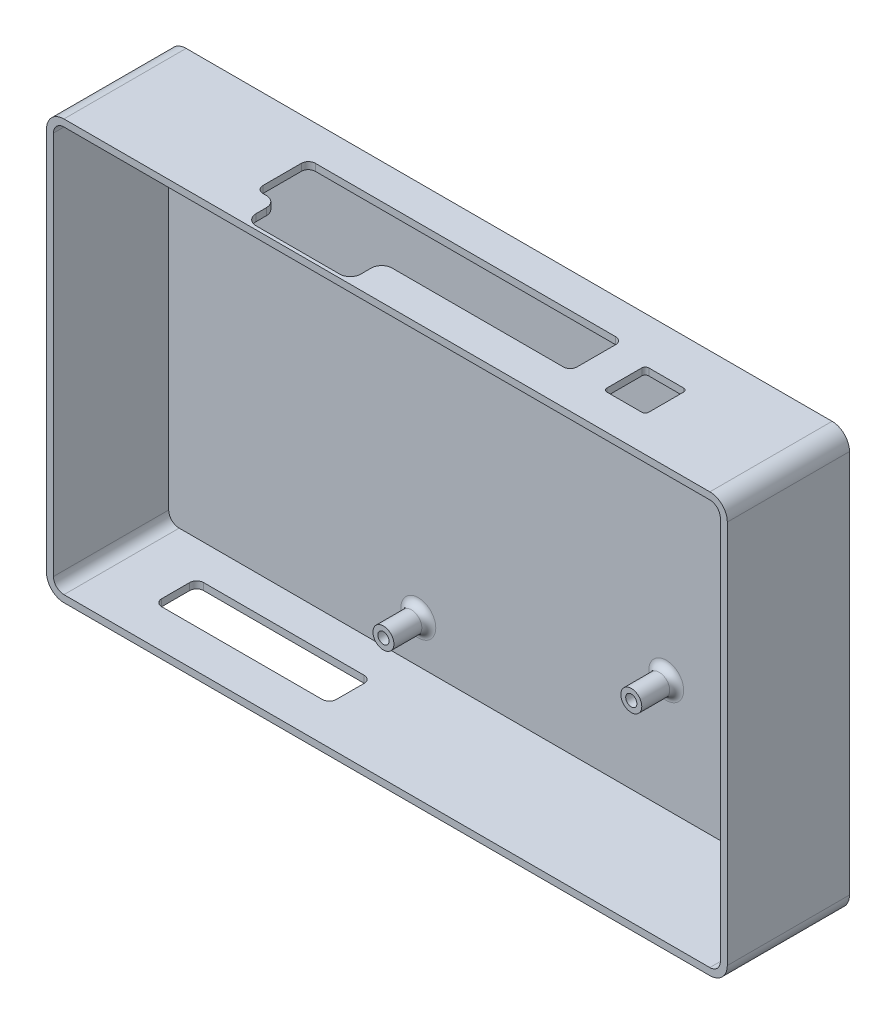
from build123d import *

# Parameters (mm, degrees)
BOSS_EXTRU_1_DEPTH      = 35
COQUE1_T                = -2
ESQUISSE2_W             = 12
ESQUISSE2_H             = 12
ENL_V_MAT_EXTRU_1_DEPTH = 10
ESQUISSE3_W             = 30
ESQUISSE3_H             = 9
ENL_V_MAT_EXTRU_2_DEPTH = 10
ESQUISSE4_W             = 50
ESQUISSE4_H             = 12
ENL_V_MAT_EXTRU_3_DEPTH = 10
CONG_1_R                = 3
CONG_2_R                = 1
CONG_3_R                = 2
ESQUISSE5_R             = 3
ESQUISSE5_R_2           = 1.6
BOSS_EXTRU_2_DEPTH      = 10
CONG_4_R                = 2


with BuildPart() as part:
    # Esquisse1 → Boss.-Extru.1 (new body)
    with BuildSketch(Plane.XY):
        with BuildLine():
            Line((5, 0), (190, 0))
            ThreePointArc((190, 0), (193.535533906, 1.464466094), (195, 5))
            Line((195, 5), (195, 115))
            ThreePointArc((195, 115), (193.535533906, 118.535533906), (190, 120))
            Line((190, 120), (5, 120))
            ThreePointArc((5, 120), (1.464466094, 118.535533906), (0, 115))
            Line((0, 115), (0, 5))
            ThreePointArc((0, 5), (1.464466094, 1.464466094), (5, 0))
        make_face()
    extrude(amount=BOSS_EXTRU_1_DEPTH)

    # Coque1
    coque1_openings = [part.faces().sort_by_distance(p)[0] for p in [
        (97.5, 60, 35),
    ]]
    offset(amount=COQUE1_T, openings=coque1_openings, kind=Kind.INTERSECTION)

    # Esquisse2 → Enlèv. mat.-Extru.1 (cut)
    with BuildSketch(Plane(origin=(0, 120, 0), x_dir=(1, 0, 0), z_dir=(0, 1, 0))):
        with Locations((155.5, -19)):
            Rectangle(ESQUISSE2_W, ESQUISSE2_H)
        with BuildLine():
            Line((52, -10), (138, -10))
            ThreePointArc((138, -10), (139.414213562, -10.585786438), (140, -12))
            Line((140, -12), (140, -23))
            ThreePointArc((140, -23), (139.414213562, -24.414213562), (138, -25))
            Line((138, -25), (52, -25))
            ThreePointArc((52, -25), (50.585786438, -24.414213562), (50, -23))
            Line((50, -23), (50, -12))
            ThreePointArc((50, -12), (50.585786438, -10.585786438), (52, -10))
        make_face()
    extrude(amount=-ENL_V_MAT_EXTRU_1_DEPTH, mode=Mode.SUBTRACT)

    # Esquisse3 → Enlèv. mat.-Extru.2 (cut)
    with BuildSketch(Plane(origin=(0, 120, 0), x_dir=(1, 0, 0), z_dir=(0, 1, 0))):
        with Locations((71, -29.5)):
            Rectangle(ESQUISSE3_W, ESQUISSE3_H)
    extrude(amount=-ENL_V_MAT_EXTRU_2_DEPTH, mode=Mode.SUBTRACT)

    # Esquisse4 → Enlèv. mat.-Extru.3 (cut)
    with BuildSketch(Plane.XZ):
        with Locations((45, 18)):
            Rectangle(ESQUISSE4_W, ESQUISSE4_H)
    extrude(amount=-ENL_V_MAT_EXTRU_3_DEPTH, mode=Mode.SUBTRACT)

    # Congé1
    cong_1_edges = [part.edges().sort_by_distance(p)[0] for p in [
        (86, 119, 25),
        (56, 119, 25),
        (56, 119, 34),
        (86, 119, 34),
    ]]
    fillet(cong_1_edges, radius=CONG_1_R)

    # Congé2
    cong_2_edges = [part.edges().sort_by_distance(p)[0] for p in [
        (149.5, 119, 25),
        (149.5, 119, 13),
        (161.5, 119, 13),
        (161.5, 119, 25),
    ]]
    fillet(cong_2_edges, radius=CONG_2_R)

    # Congé3
    cong_3_edges = [part.edges().sort_by_distance(p)[0] for p in [
        (20, 1, 12),
        (20, 1, 24),
        (70, 1, 24),
        (70, 1, 12),
    ]]
    fillet(cong_3_edges, radius=CONG_3_R)

    # Esquisse5 → Boss.-Extru.2 (add)
    # profile 1 of 4: a face of its own
    with BuildSketch(Plane.XY.offset(2)):
        with Locations((10.5, 113)):
            Circle(ESQUISSE5_R)
        with Locations((10.5, 113)):
            Circle(ESQUISSE5_R_2, mode=Mode.SUBTRACT)
    # profile 2 of 4: a face of its own
    with BuildSketch(Plane.XY.offset(2)):
        with Locations((73.5, 14)):
            Circle(ESQUISSE5_R)
        with Locations((73.5, 14)):
            Circle(ESQUISSE5_R_2, mode=Mode.SUBTRACT)
    # profile 3 of 4: a face of its own
    with BuildSketch(Plane.XY.offset(2)):
        with Locations((144.5, 34)):
            Circle(ESQUISSE5_R)
        with Locations((144.5, 34)):
            Circle(ESQUISSE5_R_2, mode=Mode.SUBTRACT)
    # profile 4 of 4: a face of its own
    with BuildSketch(Plane.XY.offset(2)):
        with Locations((183.5, 112)):
            Circle(ESQUISSE5_R)
        with Locations((183.5, 112)):
            Circle(ESQUISSE5_R_2, mode=Mode.SUBTRACT)
    extrude(amount=BOSS_EXTRU_2_DEPTH)

    # Congé4
    cong_4_edges = [part.edges().sort_by_distance(p)[0] for p in [
        (7.5, 113, 2),
        (70.5, 14, 2),
        (141.5, 34, 2),
        (180.5, 112, 2),
    ]]
    fillet(cong_4_edges, radius=CONG_4_R - 0.0001)  # a hair under: the kernel refuses the full size


solid = part.part
